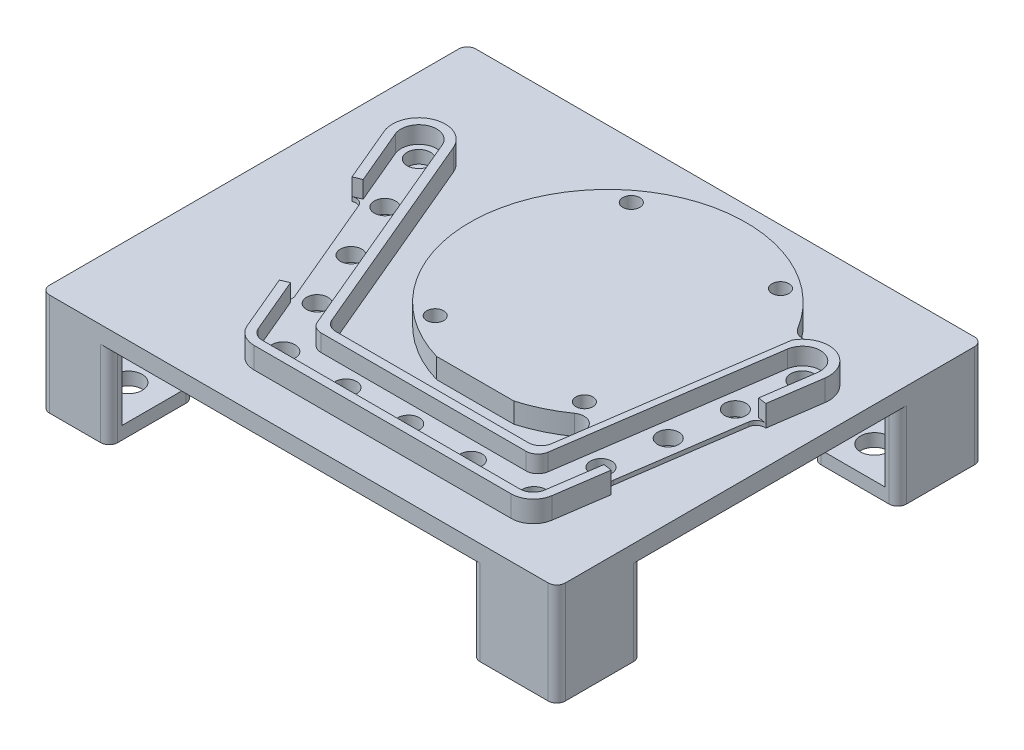
from build123d import *

# Parameters (mm, degrees)
SKETCH1_W           = 130
SKETCH1_H           = 100
BOSS_EXTRUDE1_DEPTH = 4
BOSS_EXTRUDE3_START = 4
BOSS_EXTRUDE3_DEPTH = 1
SKETCH3_R           = 1.6
CUT_EXTRUDE3_DEPTH  = 2
SKETCH5_R           = 2.5
CUT_EXTRUDE4_DEPTH  = 3.25
BOSS_EXTRUDE2_DEPTH = 5
CUT_EXTRUDE5_REACH  = 84.498
CUT_EXTRUDE6_START  = -5
CUT_EXTRUDE6_DEPTH  = 5
SKETCH10_R          = 1
BOSS_EXTRUDE4_DEPTH = 4.7244
FILLET1_R           = 3
FILLET2_R           = 3
FILLET3_START       = 3
FILLET3_DEPTH       = 6
FILLET4_START       = 3
FILLET4_DEPTH       = 5.7244
FILLET5_R           = 2
FILLET6_R           = 2
FILLET7_R           = 2
FILLET8_R           = 2
SKETCH16_R          = 2
CUT_EXTRUDE7_DEPTH  = 6
SKETCH17_R          = 2.75
CUT_EXTRUDE8_DEPTH  = 3
SKETCH18_W          = 25
SKETCH18_H          = 3
BOSS_EXTRUDE5_DEPTH = 20
SKETCH19_W          = 25
SKETCH19_H          = 20
SKETCH19_R          = 3.25
SKETCH19_W_2        = 20
SKETCH19_W_3        = 17
SKETCH19_H_2        = 17
BOSS_EXTRUDE6_DEPTH = 3
SKETCH20_W          = 100
SKETCH20_H          = 24
CUT_EXTRUDE10_DEPTH = 9
FILLET10_R          = 2


with BuildPart() as part:
    # Sketch1 → Boss-Extrude1 (new body)
    with BuildSketch(Plane(origin=(0, 0, 0), x_dir=(1, 0, 0), z_dir=(0, 1, 0))):
        Rectangle(SKETCH1_W, SKETCH1_H)
    extrude(amount=BOSS_EXTRUDE1_DEPTH)

    # Boss-Extrude3: read off the stored shape, not the designer's step
    # Boss-Extrude3 outline → Boss-Extrude3 (add)
    with BuildSketch(Plane(origin=(0, 0, 0), x_dir=(1, 0, 0), z_dir=(0, 1, 0)).offset(BOSS_EXTRUDE3_START)):
        with BuildLine():
            ThreePointArc((-33.446001745, 21.59344723), (-38.948165427, 23.830899981), (-41.185618178, 18.328736299))
            Line((-41.185618178, 18.328736299), (-17.72774219, -37.282607638))
            ThreePointArc((-17.72774219, -37.282607638), (-16.548520363, -38.70535138), (-14.779316882, -39.238908236))
            Line((-14.779316882, -39.238908236), (45.549258637, -39.238908236))
            ThreePointArc((45.549258637, -39.238908236), (47.642826881, -38.459026417), (48.715935243, -36.499515742))
            Line((48.715935243, -36.499515742), (56.840453083, 19.356544412))
            ThreePointArc((56.840453083, 19.356544412), (53.28873739, 24.117354809), (48.527926993, 20.565639116))
            Line((48.527926993, 20.565639116), (41.399551878, -28.441939804))
            ThreePointArc((41.399551878, -28.441939804), (40.460582061, -30.156511644), (38.628709848, -30.838908236))
            Line((38.628709848, -30.838908236), (-9.471261516, -30.838908236))
            ThreePointArc((-9.471261516, -30.838908236), (-11.019314561, -30.372045987), (-12.05113366, -29.127145213))
            Line((-12.05113366, -29.127145213), (-33.446001745, 21.59344723))
        make_face()
    extrude(amount=BOSS_EXTRUDE3_DEPTH)

    # Sketch3 → Cut-Extrude3 (cut)
    with BuildSketch(Plane(origin=(0, 5, 0), x_dir=(1, 0, 0), z_dir=(0, 1, 0))):
        with Locations(Location((-37.315809962, 19.961091764, 0), (0, 0, 270))):
            Circle(SKETCH3_R)
        with Locations(Location((-14.115809962, -35.038908236, 0), (0, 0, 270))):
            Circle(SKETCH3_R)
        with Locations(Location((44.684190038, -35.038908236, 0), (0, 0, 270))):
            Circle(SKETCH3_R)
        with Locations(Location((52.684190038, 19.961091764, 0), (0, 0, 270))):
            Circle(SKETCH3_R)
    extrude(amount=-CUT_EXTRUDE3_DEPTH, mode=Mode.SUBTRACT)

    # Sketch5 → Cut-Extrude4 (cut)
    with BuildSketch(Plane(origin=(0, 5, 0), x_dir=(1, 0, 0), z_dir=(0, 1, 0))):
        with Locations(Location((-31.515809962, 6.211091764, 0), (0, 0, 270))):
            Circle(SKETCH5_R)
        with Locations(Location((15.284190038, -35.038908236, 0), (0, 0, 270))):
            Circle(SKETCH5_R)
        with Locations(Location((46.684190038, -21.288908236, 0), (0, 0, 270))):
            Circle(SKETCH5_R)
        with Locations(Location((-19.915809962, -21.288908236, 0), (0, 0, 270))):
            Circle(SKETCH5_R)
        with Locations(Location((50.684190038, 6.211091764, 0), (0, 0, 270))):
            Circle(SKETCH5_R)
        with Locations(Location((-25.715809962, -7.538908236, 0), (0, 0, 270))):
            Circle(SKETCH5_R)
        with Locations(Location((0.584190038, -35.038908236, 0), (0, 0, 270))):
            Circle(SKETCH5_R)
        with Locations(Location((29.984190038, -35.038908236, 0), (0, 0, 270))):
            Circle(SKETCH5_R)
        with Locations(Location((48.684190038, -7.538908236, 0), (0, 0, 270))):
            Circle(SKETCH5_R)
    extrude(amount=-CUT_EXTRUDE4_DEPTH, mode=Mode.SUBTRACT)

    # Sketch6 → Boss-Extrude2 (add)
    with BuildSketch(Plane(origin=(0, 4, 0), x_dir=(1, 0, 0), z_dir=(0, 1, 0))):
        with BuildLine():
            Line((46.548754115, 20.853518808), (39.420378999, -28.154060112))
            ThreePointArc((39.420378999, -28.154060112), (39.152101909, -28.643937781), (38.628709848, -28.838908236))
            Line((38.628709848, -28.838908236), (-9.471261516, -28.838908236))
            ThreePointArc((-9.471261516, -28.838908236), (-9.913562386, -28.705519022), (-10.208367842, -28.349833086))
            Line((-10.208367842, -28.349833086), (-31.603235928, 22.370759357))
            ThreePointArc((-31.603235928, 22.370759357), (-39.725477554, 25.673665798), (-43.028383996, 17.551424172))
            Line((-43.028383996, 17.551424172), (-19.570508008, -38.059919765))
            ThreePointArc((-19.570508008, -38.059919765), (-17.654272538, -40.371878346), (-14.779316882, -41.238908236))
            Line((-14.779316882, -41.238908236), (45.549258637, -41.238908236))
            ThreePointArc((45.549258637, -41.238908236), (48.951307033, -39.97160028), (50.695108121, -36.787395433))
            Line((50.695108121, -36.787395433), (58.819625962, 19.068664721))
            ThreePointArc((58.819625962, 19.068664721), (53.576617082, 26.096527688), (46.548754115, 20.853518808))
        make_face()
        with BuildLine():
            Line((-9.471261516, -30.838908236), (38.628709848, -30.838908236))
            ThreePointArc((38.628709848, -30.838908236), (40.460582061, -30.156511644), (41.399551878, -28.441939804))
            Line((41.399551878, -28.441939804), (48.527926993, 20.565639116))
            ThreePointArc((48.527926993, 20.565639116), (53.28873739, 24.117354809), (56.840453083, 19.356544412))
            Line((56.840453083, 19.356544412), (48.715935243, -36.499515742))
            ThreePointArc((48.715935243, -36.499515742), (47.642826881, -38.459026417), (45.549258637, -39.238908236))
            Line((45.549258637, -39.238908236), (-14.779316882, -39.238908236))
            ThreePointArc((-14.779316882, -39.238908236), (-16.548520363, -38.70535138), (-17.72774219, -37.282607638))
            Line((-17.72774219, -37.282607638), (-41.185618178, 18.328736299))
            ThreePointArc((-41.185618178, 18.328736299), (-38.948165427, 23.830899981), (-33.446001745, 21.59344723))
            Line((-33.446001745, 21.59344723), (-12.05113366, -29.127145213))
            ThreePointArc((-12.05113366, -29.127145213), (-11.019314561, -30.372045987), (-9.471261516, -30.838908236))
        make_face(mode=Mode.SUBTRACT)
    extrude(amount=BOSS_EXTRUDE2_DEPTH)

    # Cut-Extrude5: up to this face of the body (flat: up to its plane)
    cut_extrude5_end = Plane(part.part.faces().sort_by_distance((-2.466479054, 4, -3.147028134))[0])
    # Sketch9 → Cut-Extrude5 (cut, up to the picked face)
    with BuildSketch(Plane(origin=(0, 9, 0), x_dir=(1, 0, 0), z_dir=(0, 1, 0)), mode=Mode.PRIVATE) as cut_extrude5_sk1:
        Polygon((-23.238183171, -24.219062209), (-35.675177197, 5.26519087), (-37.517943015, 4.487878743), (-25.080948989, -24.996374336), align=None)
    cut_extrude5_tool1 = split(extrude(cut_extrude5_sk1.sketch, amount=-CUT_EXTRUDE5_REACH, mode=Mode.PRIVATE), bisect_by=cut_extrude5_end, keep=Keep.BOTH, mode=Mode.PRIVATE)
    # Sketch9 → Cut-Extrude5 (cut, up to the picked face)
    with BuildSketch(Plane(origin=(0, 9, 0), x_dir=(1, 0, 0), z_dir=(0, 1, 0)), mode=Mode.PRIVATE) as cut_extrude5_sk2:
        Polygon((55.081231695, 7.261897364), (50.475156632, -24.404868693), (52.45432951, -24.692748385), (57.060404573, 6.974017672), align=None)
    cut_extrude5_tool2 = split(extrude(cut_extrude5_sk2.sketch, amount=-CUT_EXTRUDE5_REACH, mode=Mode.PRIVATE), bisect_by=cut_extrude5_end, keep=Keep.BOTH, mode=Mode.PRIVATE)
    add(cut_extrude5_tool1.solids().sort_by(Axis((-30.378063, 9, 9.865592), (0, -1, 0)))[0], mode=Mode.SUBTRACT)
    add(cut_extrude5_tool2.solids().sort_by(Axis((53.767781, 9, 8.715426), (0, -1, 0)))[0], mode=Mode.SUBTRACT)

    # Sketch11 → Cut-Extrude6 (cut)
    with BuildSketch(Plane(origin=(0, 9, 0), x_dir=(1, 0, 0), z_dir=(0, 1, 0)).offset(CUT_EXTRUDE6_START)):
        with BuildLine():
            Line((47.259945092, 22.964018131), (39.724973984, -28.838908236))
            Line((39.724973984, -28.838908236), (38.628709848, -28.838908236))
            ThreePointArc((38.628709848, -28.838908236), (39.152101909, -28.643937781), (39.420378999, -28.154060112))
            Line((39.420378999, -28.154060112), (46.548754115, 20.853518808))
            ThreePointArc((46.548754115, 20.853518808), (46.808808578, 21.940963654), (47.259945092, 22.964018131))
        make_face()
    extrude(amount=CUT_EXTRUDE6_DEPTH, mode=Mode.SUBTRACT)

    # Sketch10 → Boss-Extrude4 (add)
    with BuildSketch(Plane(origin=(0, 4, 0), x_dir=(1, 0, 0), z_dir=(0, 1, 0))):
        with BuildLine():
            Line((8.603375751, -21.785908236), (26.725004326, -21.785908236))
            ThreePointArc((26.725004326, -21.785908236), (35.181528618, -17.93489214), (42.197245669, -11.842040402))
            Line((42.197245669, -11.842040402), (47.209726817, 22.618767488))
            ThreePointArc((47.209726817, 22.618767488), (-6.786776617, 30.57953238), (8.603375751, -21.785908236))
        make_face()
        with Locations(Location((0.164190038, 32.321352082, 0), (0, 0, 270))):
            Circle(SKETCH10_R, mode=Mode.SUBTRACT)
        with Locations(Location((0.164190038, -13.678647918, 0), (0, 0, 270))):
            Circle(SKETCH10_R, mode=Mode.SUBTRACT)
        with Locations(Location((35.164190038, -13.678647918, 0), (0, 0, 270))):
            Circle(SKETCH10_R, mode=Mode.SUBTRACT)
        with Locations(Location((35.164190038, 32.321352082, 0), (0, 0, 270))):
            Circle(SKETCH10_R, mode=Mode.SUBTRACT)
    extrude(amount=BOSS_EXTRUDE4_DEPTH)

    # Fillet1
    fillet1_edges = [part.edges().sort_by_distance(p)[0] for p in [
        (42.197245669, 6.3622, 11.842040402),
    ]]
    fillet(fillet1_edges, radius=FILLET1_R)

    # Fillet2
    fillet2_edges = [part.edges().sort_by_distance(p)[0] for p in [
        (39.724973984, 6.5, 28.838908236),
    ]]
    fillet(fillet2_edges, radius=FILLET2_R)

    # Fillet3: read off the stored shape, not the designer's step
    # Fillet3 outline → Fillet3 (add)
    with BuildSketch(Plane(origin=(0, 0, 0), x_dir=(1, 0, 0), z_dir=(0, 1, 0)).offset(FILLET3_START)):
        with BuildLine():
            ThreePointArc((-8.01154629, -28.838908236), (-9.670174553, -28.338698684), (-10.775695016, -27.004876425))
            Line((-10.775695016, -27.004876425), (-10.208367842, -28.349833086))
            ThreePointArc((-10.208367842, -28.349833086), (-9.913562386, -28.705519022), (-9.471261516, -28.838908236))
            Line((-9.471261516, -28.838908236), (-8.01154629, -28.838908236))
        make_face()
    extrude(amount=FILLET3_DEPTH)

    # Fillet4: read off the stored shape, not the designer's step
    # Fillet4 outline → Fillet4 (add)
    with BuildSketch(Plane(origin=(0, 0, 0), x_dir=(1, 0, 0), z_dir=(0, 1, 0)).offset(FILLET4_START)):
        with BuildLine():
            ThreePointArc((49.433950838, 25.240859291), (47.162812562, 24.878021645), (45.302181195, 26.229972511))
            ThreePointArc((45.302181195, 26.229972511), (46.312910206, 24.454455954), (47.209726817, 22.618767488))
            Line((47.209726817, 22.618767488), (47.259945092, 22.964018131))
            ThreePointArc((47.259945092, 22.964018131), (48.200032345, 24.242718766), (49.433950838, 25.240859291))
        make_face()
    extrude(amount=FILLET4_DEPTH)

    # Fillet5
    fillet5_edges = [part.edges().sort_by_distance(p)[0] for p in [
        (55.081231695, 4.5, -7.261897364),
    ]]
    fillet(fillet5_edges, radius=FILLET5_R - 0.0001)  # a hair under: the kernel refuses the full size

    # Fillet6
    fillet6_edges = [part.edges().sort_by_distance(p)[0] for p in [
        (50.475156632, 4.5, 24.404868693),
    ]]
    fillet(fillet6_edges, radius=FILLET6_R - 0.0001)  # a hair under: the kernel refuses the full size

    # Fillet7
    fillet7_edges = [part.edges().sort_by_distance(p)[0] for p in [
        (-23.238183171, 4.5, 24.219062209),
    ]]
    fillet(fillet7_edges, radius=FILLET7_R - 0.0001)  # a hair under: the kernel refuses the full size

    # Fillet8
    fillet8_edges = [part.edges().sort_by_distance(p)[0] for p in [
        (-35.675177197, 4.5, -5.26519087),
    ]]
    fillet(fillet8_edges, radius=FILLET8_R - 0.0001)  # a hair under: the kernel refuses the full size

    # Sketch16 → Cut-Extrude7 (cut)
    with BuildSketch(Plane(origin=(0, 8.7244, 0), x_dir=(1, 0, 0), z_dir=(0, 1, 0))):
        with Locations(Location((0.164190038, 32.321352082, 0), (0, 0, 270))):
            Circle(SKETCH16_R)
        with Locations(Location((35.164190038, 32.321352082, 0), (0, 0, 270))):
            Circle(SKETCH16_R)
        with Locations(Location((0.164190038, -13.678647918, 0), (0, 0, 270))):
            Circle(SKETCH16_R)
        with Locations(Location((35.164190038, -13.678647918, 0), (0, 0, 270))):
            Circle(SKETCH16_R)
    extrude(amount=-CUT_EXTRUDE7_DEPTH, mode=Mode.SUBTRACT)

    # Sketch17 → Cut-Extrude8 (cut)
    with BuildSketch(Plane(origin=(0, 5, 0), x_dir=(1, 0, 0), z_dir=(0, 1, 0))):
        with Locations(Location((-37.315809962, 19.961091764, 0), (0, 0, 270))):
            Circle(SKETCH17_R)
        with Locations(Location((-14.115809962, -35.038908236, 0), (0, 0, 270))):
            Circle(SKETCH17_R)
        with Locations(Location((44.684190038, -35.038908236, 0), (0, 0, 270))):
            Circle(SKETCH17_R)
        with Locations(Location((52.684190038, 19.961091764, 0), (0, 0, 270))):
            Circle(SKETCH17_R)
    extrude(amount=-CUT_EXTRUDE8_DEPTH, mode=Mode.SUBTRACT)

    # Sketch18 → Boss-Extrude5 (add)
    with BuildSketch(Plane.XZ):
        Polygon((65, -30), (65, -50), (45, -50), (45, -47), (62, -47), (62, -30), align=None)
        with Locations((-52.5, -48.5)):
            Rectangle(SKETCH18_W, SKETCH18_H)
        Polygon((65, 30), (62, 30), (62, 47), (45, 47), (45, 50), (65, 50), align=None)
        with Locations((-52.5, 48.5)):
            Rectangle(SKETCH18_W, SKETCH18_H)
    extrude(amount=BOSS_EXTRUDE5_DEPTH)

    # Sketch19 → Boss-Extrude6 (add)
    # profile 1 of 5: a face of its own
    with BuildSketch(Plane.XZ.offset(20)):
        with Locations((-52.5, 40)):
            Rectangle(SKETCH19_W, SKETCH19_H)
        with Locations(Location((-48, 37.5, 0), (0, 0, 270))):
            Circle(SKETCH19_R, mode=Mode.SUBTRACT)
    # profile 2 of 5: a face of its own
    with BuildSketch(Plane.XZ.offset(20)):
        with Locations((-52.5, -40)):
            Rectangle(SKETCH19_W, SKETCH19_H)
        with Locations(Location((-48, -37.5, 0), (0, 0, 270))):
            Circle(SKETCH19_R, mode=Mode.SUBTRACT)
    # profile 3 of 5: a face of its own
    with BuildSketch(Plane.XZ.offset(20)):
        with Locations((55, -40)):
            Rectangle(SKETCH19_W_2, SKETCH19_H)
        with Locations(Location((52, -37.5, 0), (0, 0, 270))):
            Circle(SKETCH19_R, mode=Mode.SUBTRACT)
    # profile 4 of 5: a face of its own
    with BuildSketch(Plane.XZ.offset(20)):
        with Locations((53.5, 38.5)):
            Rectangle(SKETCH19_W_3, SKETCH19_H_2)
        with Locations(Location((52, 37.5, 0), (0, 0, 270))):
            Circle(SKETCH19_R, mode=Mode.SUBTRACT)
    # profile 5 of 5: a face of its own
    with BuildSketch(Plane.XZ.offset(20)):
        Polygon((65, 30), (65, 50), (45, 50), (45, 47), (62, 47), (62, 30), align=None)
    extrude(amount=-BOSS_EXTRUDE6_DEPTH)

    # Sketch20 → Cut-Extrude10 (cut)
    with BuildSketch(Plane.ZY.offset(65)):
        with Locations((0, -8)):
            Rectangle(SKETCH20_W, SKETCH20_H)
    extrude(amount=-CUT_EXTRUDE10_DEPTH, mode=Mode.SUBTRACT)

    # Fillet10
    fillet10_edges = [part.edges().sort_by_distance(p)[0] for p in [
        (65, -10, -30),
        (45, -10, -50),
        (45, -10, 50),
        (65, -10, 30),
        (-40, -10, -50),
        (-40, -10, 50),
        (-40, -18.5, 30),
        (-40, -18.5, -30),
        (45, -18.5, -30),
        (45, -18.5, 30),
        (-56, -18.5, -30),
        (-56, -8, -50),
        (-56, -18.5, 30),
        (-56, -8, 50),
        (65, -8, -50),
        (65, -8, 50),
    ]]
    fillet(fillet10_edges, radius=FILLET10_R)


solid = part.part
